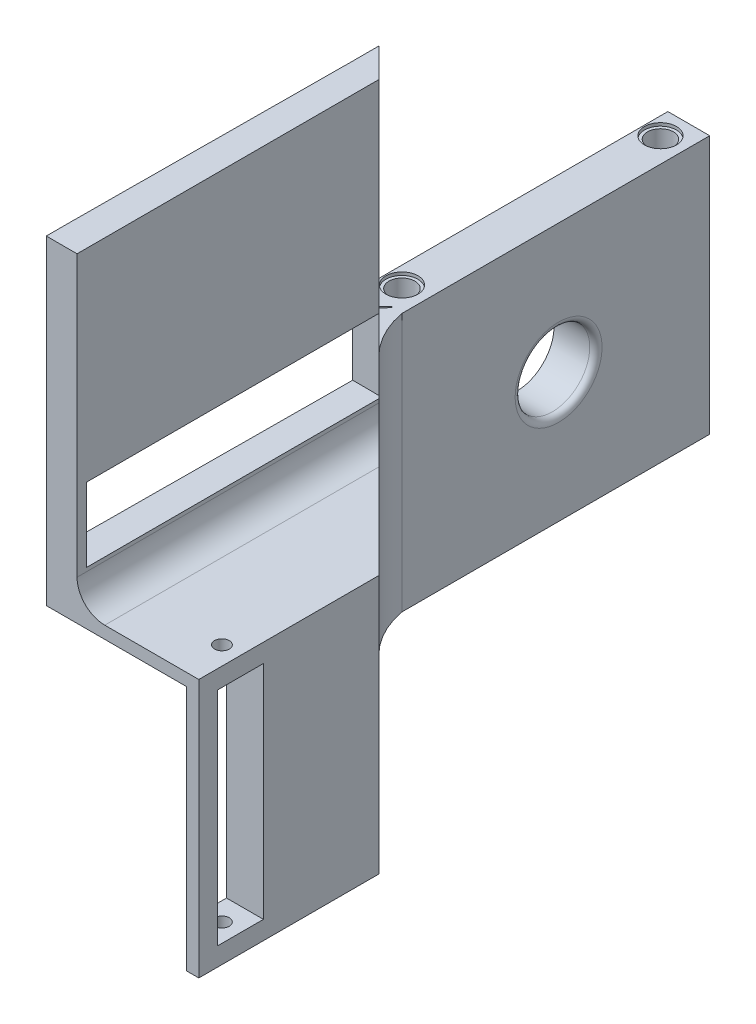
from build123d import *

# Parameters (mm, degrees)
SKETCH1_W           = 25
SKETCH1_H           = 50
SKETCH1_R           = 3.4
BOSS_EXTRUDE1_DEPTH = 3
SKETCH2_W           = 50
SKETCH2_H           = 3
BOSS_EXTRUDE2_DEPTH = 8
SKETCH3_W           = 8
SKETCH3_H           = 50
BOSS_EXTRUDE3_DEPTH = 42
SKETCH4_R           = 2.65
CUT_EXTRUDE1_DEPTH  = 0.5
SKETCH5_R           = 6.062177826
CUT_EXTRUDE2_DEPTH  = 9
FILLET2_R           = 1
SKETCH6_R           = 12.6
BOSS_EXTRUDE4_DEPTH = 2
FILLET4_R           = 1
SKETCH8_R           = 1.589780168
SKETCH8_R_2         = 1.777428262
CUT_EXTRUDE3_DEPTH  = 10
SKETCH9_W           = 49.021678163
SKETCH9_H           = 20.976854622
CUT_EXTRUDE4_DEPTH  = 68.79439129
SKETCH11_R          = 2.1
CUT_EXTRUDE5_DEPTH  = 59.480168703
SKETCH14_R          = 2.6
CUT_EXTRUDE6_DEPTH  = 0.5
BOSS_EXTRUDE5_DEPTH = 42
FILLET5_R           = 15
BOSS_EXTRUDE6_DEPTH = 42
SKETCH18_W          = 7.5
SKETCH18_H          = 36
CUT_EXTRUDE7_DEPTH  = 8
SKETCH19_R          = 1.2
CUT_EXTRUDE8_DEPTH  = 96.073366415
FILL_START          = -24.41711757
FILL_PATTERN1_DEPTH = 4.904046836
CHAMFER1_SIZE       = 4
CUT_EXTRUDE9_DEPTH  = 96.073366415
BOSS_EXTRUDE7_DEPTH = 2
BOSS_EXTRUDE8_DEPTH = 50
BOSS_EXTRUDE9_DEPTH = 4
SKETCH24_W          = 47.897956882
SKETCH24_H          = 11.99424148
CUT_EXTRUDE10_DEPTH = 6
FILLET7_R           = 4.5
SKETCH25_W          = 50
SKETCH25_H          = 42
CUT_EXTRUDE11_DEPTH = 1.2


# Read off the part's stored shape, not the designer's step: Fill Pattern1
with BuildPart() as part:
    # Sketch1 → Boss-Extrude1 (new body)
    with BuildSketch(Plane(origin=(0, 0, 0), x_dir=(1, 0, 0), z_dir=(0, 1, 0))):
        with Locations((2.276951673, 11.384758364)):
            Rectangle(SKETCH1_W, SKETCH1_H)
        with Locations(Location((1.276951673, 11.384758364, 0), (0, 0, 270))):
            Circle(SKETCH1_R, mode=Mode.SUBTRACT)
    extrude(amount=BOSS_EXTRUDE1_DEPTH)

    # Sketch2 → Boss-Extrude2 (add)
    with BuildSketch(Plane.ZY.offset(10.223048327)):
        with Locations((-11.384758364, 1.5)):
            Rectangle(SKETCH2_W, SKETCH2_H)
    extrude(amount=BOSS_EXTRUDE2_DEPTH)

    # Sketch3 → Boss-Extrude3 (add)
    with BuildSketch(Plane.XZ):
        with Locations((-14.223048327, -11.384758364)):
            Rectangle(SKETCH3_W, SKETCH3_H)
    extrude(amount=BOSS_EXTRUDE3_DEPTH)

    # Sketch4 → Cut-Extrude1 (cut)
    with BuildSketch(Plane(origin=(0, 3, 0), x_dir=(1, 0, 0), z_dir=(0, 1, 0))):
        with Locations(Location((-14.223048327, 32.384758364, 0), (0, 0, 270))):
            Circle(SKETCH4_R)
        with Locations(Location((-14.223048327, -9.615241636, 0), (0, 0, 270))):
            Circle(SKETCH4_R)
    cut_extrude1 = extrude(amount=-CUT_EXTRUDE1_DEPTH, mode=Mode.SUBTRACT)

    # Mirror1: Cut-Extrude1 across plane
    add(cut_extrude1.mirror(Plane.ZX.offset(-19.5)), mode=Mode.SUBTRACT)

    # Sketch5 → Cut-Extrude2 (cut)
    with BuildSketch(Plane.ZY.offset(18.223048327)):
        with Locations((-11.836279124, -21)):
            Circle(SKETCH5_R)
    extrude(amount=-CUT_EXTRUDE2_DEPTH, mode=Mode.SUBTRACT)

    # Fillet2
    fillet2_edges = [part.edges().sort_by_distance(p)[0] for p in [
        (-10.223048327, -21, -17.89845695),
    ]]
    fillet(fillet2_edges, radius=FILLET2_R)

    # Mirror2: Cut-Extrude1 across plane
    add(cut_extrude1.mirror(Plane.ZY.offset(1.723048327)), mode=Mode.SUBTRACT)

    # Sketch6 → Boss-Extrude4 (add)
    with BuildSketch(Plane(origin=(0, 3, 0), x_dir=(1, 0, 0), z_dir=(0, 1, 0))):
        with BuildLine():
            Line((14.776951673, 5.825082115), (14.776951673, 16.944434614))
            ThreePointArc((14.776951673, 16.944434614), (-13.323048327, 11.384758364), (14.776951673, 5.825082115))
        make_face()
        with Locations(Location((1.276951673, 11.384758364, 0), (0, 0, 270))):
            Circle(SKETCH6_R, mode=Mode.SUBTRACT)
    extrude(amount=BOSS_EXTRUDE4_DEPTH)

    # Fillet4
    # the kernel refuses this fillet: 1 mm, written as the material it takes off along each edge
    with BuildSketch(Plane(origin=(14.776951673, 5, -3.325082115), x_dir=(0, -1, 0), z_dir=(0, 0, -1))) as fillet4_piece_1:
        with BuildLine():
            CenterArc((FILLET4_R, FILLET4_R), FILLET4_R, 180, 90)
            Line((0, FILLET4_R), (0, 0))
            Line((0, 0), (FILLET4_R, 0))
        make_face()
    extrude(amount=16.119352499, mode=Mode.SUBTRACT)

    # Sketch8 → Cut-Extrude3 (cut)
    with BuildSketch(Plane(origin=(0, 3, 0), x_dir=(1, 0, 0), z_dir=(0, 1, 0))):
        with Locations(Location((1.276951673, 19.884758364, 0), (0, 0, 270))):
            Circle(SKETCH8_R)
        with Locations(Location((1.276951673, 2.884758364, 0), (0, 0, 270))):
            Circle(SKETCH8_R_2)
    extrude(amount=-CUT_EXTRUDE3_DEPTH, mode=Mode.SUBTRACT)

    # Sketch9 → Cut-Extrude4 (cut, through all)
    with BuildSketch(Plane.XY.offset(13.615241636)):
        with Locations((-9.733887409, 10.488427311)):
            Rectangle(SKETCH9_W, SKETCH9_H)
    extrude(amount=-CUT_EXTRUDE4_DEPTH, mode=Mode.SUBTRACT)

    # Sketch11 → Cut-Extrude5 (cut, through all)
    with BuildSketch(Plane(origin=(0, 0, 0), x_dir=(1, 0, 0), z_dir=(0, 1, 0))):
        with Locations(Location((-14.223048327, 32.384758364, 0), (0, 0, 270))):
            Circle(SKETCH11_R)
    cut_extrude5 = extrude(amount=-CUT_EXTRUDE5_DEPTH, mode=Mode.SUBTRACT)

    # Mirror3: Cut-Extrude5 across plane
    add(cut_extrude5.mirror(Plane.XY.offset(-11.384758364)), mode=Mode.SUBTRACT)

    # Sketch14 → Cut-Extrude6 (cut)
    with BuildSketch(Plane(origin=(0, 0, 0), x_dir=(1, 0, 0), z_dir=(0, 1, 0))):
        with Locations(Location((-14.223048327, -9.615241636, 0), (0, 0, 270))):
            Circle(SKETCH14_R)
    cut_extrude6 = extrude(amount=-CUT_EXTRUDE6_DEPTH, mode=Mode.SUBTRACT)

    # Mirror4: Cut-Extrude6 across plane
    add(cut_extrude6.mirror(Plane.XY.offset(-11.384758364)), mode=Mode.SUBTRACT)

    # Sketch16 → Boss-Extrude5 (add)
    with BuildSketch(Plane(origin=(0, 0, 0), x_dir=(1, 0, 0), z_dir=(0, 1, 0))):
        Polygon((-18.223048327, -13.615241636), (24.776951673, -56.615241636), (24.776951673, -52.372600949), (-13.98040764, -13.615241636), align=None)
    extrude(amount=-BOSS_EXTRUDE5_DEPTH)

    # Fillet5
    # the kernel refuses this fillet: 15 mm, written as the material it adds along each edge
    with BuildSketch(Plane(origin=(-13.98040764, 0, 13.615241636), x_dir=(1, 0, 0), z_dir=(0, -1, 0))) as fillet5_piece_1:
        with BuildLine():
            CenterArc((18.512169169, -2.701034267), FILLET5_R, 135, 34.626223963)
            Line((7.905567451, 7.905567451), (0, 0))
            Line((0, 0), (3.757359313, 0))
        make_face()
    extrude(amount=42)

    # Sketch17 → Boss-Extrude6 (add)
    with BuildSketch(Plane(origin=(0, 0, 0), x_dir=(1, 0, 0), z_dir=(0, 1, 0))):
        Polygon((24.776951673, -56.615241636), (24.776951673, -81.615241636), (18.776951673, -81.615241636), (18.776951673, -50.615241636), align=None)
    extrude(amount=-BOSS_EXTRUDE6_DEPTH)

    # Sketch18 → Cut-Extrude7 (cut)
    with BuildSketch(Plane(origin=(24.776951673, 0, 0), x_dir=(0, 0, -1), z_dir=(1, 0, 0))):
        with Locations((-74.865241636, -21)):
            Rectangle(SKETCH18_W, SKETCH18_H)
    extrude(amount=-CUT_EXTRUDE7_DEPTH, mode=Mode.SUBTRACT)

    # Sketch19 → Cut-Extrude8 (cut, through all)
    with BuildSketch(Plane(origin=(0, 0, 0), x_dir=(1, 0, 0), z_dir=(0, 1, 0))):
        with Locations(Location((21.776951673, -74.865241636, 0), (0, 0, 270))):
            Circle(SKETCH19_R)
    extrude(amount=-CUT_EXTRUDE8_DEPTH, mode=Mode.SUBTRACT)

    # Fill Pattern1 outline → Fill Pattern1 (cut)
    with BuildSketch(Plane(origin=(0, 0, 0), x_dir=(0.7071067811865468, 0, 0.7071067811865482), z_dir=(0.7071067811865481, 0, -0.707106781186547)).offset(FILL_START)):
        Polygon((45.971737286, 5.859685187), (47.221737286, 3.694621678), (49.721737286, 3.694621678), (50.971737286, 5.859685187), (49.721737286, 8.024748697), (47.221737286, 8.024748697), align=None)
        Polygon((30.237460587, 33.11225185), (31.487460587, 30.947188341), (33.987460587, 30.947188341), (35.237460587, 33.11225185), (33.987460587, 35.27731536), (31.487460587, 35.27731536), align=None)
        Polygon((40.726978386, 14.943874075), (41.976978386, 12.778810565), (44.476978386, 12.778810565), (45.726978386, 14.943874075), (44.476978386, 17.108937584), (41.976978386, 17.108937584), align=None)
        Polygon((35.482219487, 24.028062963), (36.732219487, 21.862999453), (39.232219487, 21.862999453), (40.482219487, 24.028062963), (39.232219487, 26.193126472), (36.732219487, 26.193126472), align=None)
        Polygon((15.753183888, 3.694621678), (18.253183888, 3.694621678), (19.503183888, 5.859685187), (18.253183888, 8.024748697), (15.753183888, 8.024748697), (14.503183888, 5.859685187), align=None)
        Polygon((26.242701687, 3.694621678), (28.742701687, 3.694621678), (29.992701687, 5.859685187), (28.742701687, 8.024748697), (26.242701687, 8.024748697), (24.992701687, 5.859685187), align=None)
        Polygon((36.732219487, 3.694621678), (39.232219487, 3.694621678), (40.482219487, 5.859685187), (39.232219487, 8.024748697), (36.732219487, 8.024748697), (35.482219487, 5.859685187), align=None)
        Polygon((45.971737286, 11.915811112), (47.221737286, 9.750747603), (49.721737286, 9.750747603), (50.971737286, 11.915811112), (49.721737286, 14.080874622), (47.221737286, 14.080874622), align=None)
        Polygon((40.726978386, 21), (41.976978386, 18.834936491), (44.476978386, 18.834936491), (45.726978386, 21), (44.476978386, 23.165063509), (41.976978386, 23.165063509), align=None)
        Polygon((35.482219487, 30.084188888), (36.732219487, 27.919125378), (39.232219487, 27.919125378), (40.482219487, 30.084188888), (39.232219487, 32.249252397), (36.732219487, 32.249252397), align=None)
        Polygon((15.753183888, 9.750747603), (18.253183888, 9.750747603), (19.503183888, 11.915811112), (18.253183888, 14.080874622), (15.753183888, 14.080874622), (14.503183888, 11.915811112), align=None)
        Polygon((26.242701687, 9.750747603), (28.742701687, 9.750747603), (29.992701687, 11.915811112), (28.742701687, 14.080874622), (26.242701687, 14.080874622), (24.992701687, 11.915811112), align=None)
        Polygon((36.732219487, 9.750747603), (39.232219487, 9.750747603), (40.482219487, 11.915811112), (39.232219487, 14.080874622), (36.732219487, 14.080874622), (35.482219487, 11.915811112), align=None)
        Polygon((45.971737286, 17.971937037), (47.221737286, 15.806873528), (49.721737286, 15.806873528), (50.971737286, 17.971937037), (49.721737286, 20.137000547), (47.221737286, 20.137000547), align=None)
        Polygon((40.726978386, 27.056125925), (41.976978386, 24.891062416), (44.476978386, 24.891062416), (45.726978386, 27.056125925), (44.476978386, 29.221189435), (41.976978386, 29.221189435), align=None)
        Polygon((35.482219487, 36.140314813), (36.732219487, 33.975251303), (39.232219487, 33.975251303), (40.482219487, 36.140314813), (39.232219487, 38.305378322), (36.732219487, 38.305378322), align=None)
        Polygon((15.753183888, 15.806873528), (18.253183888, 15.806873528), (19.503183888, 17.971937037), (18.253183888, 20.137000547), (15.753183888, 20.137000547), (14.503183888, 17.971937037), align=None)
        Polygon((26.242701687, 15.806873528), (28.742701687, 15.806873528), (29.992701687, 17.971937037), (28.742701687, 20.137000547), (26.242701687, 20.137000547), (24.992701687, 17.971937037), align=None)
        Polygon((36.732219487, 15.806873528), (39.232219487, 15.806873528), (40.482219487, 17.971937037), (39.232219487, 20.137000547), (36.732219487, 20.137000547), (35.482219487, 17.971937037), align=None)
        Polygon((44.476978386, 6.72268464), (45.726978386, 8.88774815), (44.476978386, 11.052811659), (41.976978386, 11.052811659), (40.726978386, 8.88774815), (41.976978386, 6.72268464), align=None)
        Polygon((45.971737286, 24.028062963), (47.221737286, 21.862999453), (49.721737286, 21.862999453), (50.971737286, 24.028062963), (49.721737286, 26.193126472), (47.221737286, 26.193126472), align=None)
        Polygon((40.726978386, 33.11225185), (41.976978386, 30.947188341), (44.476978386, 30.947188341), (45.726978386, 33.11225185), (44.476978386, 35.27731536), (41.976978386, 35.27731536), align=None)
        Polygon((15.753183888, 21.862999453), (18.253183888, 21.862999453), (19.503183888, 24.028062963), (18.253183888, 26.193126472), (15.753183888, 26.193126472), (14.503183888, 24.028062963), align=None)
        Polygon((26.242701687, 21.862999453), (28.742701687, 21.862999453), (29.992701687, 24.028062963), (28.742701687, 26.193126472), (26.242701687, 26.193126472), (24.992701687, 24.028062963), align=None)
        Polygon((45.971737286, 36.140314813), (47.221737286, 33.975251303), (49.721737286, 33.975251303), (50.971737286, 36.140314813), (49.721737286, 38.305378322), (47.221737286, 38.305378322), align=None)
        Polygon((15.753183888, 33.975251303), (18.253183888, 33.975251303), (19.503183888, 36.140314813), (18.253183888, 38.305378322), (15.753183888, 38.305378322), (14.503183888, 36.140314813), align=None)
        Polygon((26.242701687, 33.975251303), (28.742701687, 33.975251303), (29.992701687, 36.140314813), (28.742701687, 38.305378322), (26.242701687, 38.305378322), (24.992701687, 36.140314813), align=None)
        Polygon((33.987460587, 6.72268464), (35.237460587, 8.88774815), (33.987460587, 11.052811659), (31.487460587, 11.052811659), (30.237460587, 8.88774815), (31.487460587, 6.72268464), align=None)
        Polygon((45.971737286, 30.084188888), (47.221737286, 27.919125378), (49.721737286, 27.919125378), (50.971737286, 30.084188888), (49.721737286, 32.249252397), (47.221737286, 32.249252397), align=None)
        Polygon((15.753183888, 27.919125378), (18.253183888, 27.919125378), (19.503183888, 30.084188888), (18.253183888, 32.249252397), (15.753183888, 32.249252397), (14.503183888, 30.084188888), align=None)
        Polygon((26.242701687, 27.919125378), (28.742701687, 27.919125378), (29.992701687, 30.084188888), (28.742701687, 32.249252397), (26.242701687, 32.249252397), (24.992701687, 30.084188888), align=None)
        Polygon((19.747942788, 27.056125925), (20.997942788, 24.891062416), (23.497942788, 24.891062416), (24.747942788, 27.056125925), (23.497942788, 29.221189435), (20.997942788, 29.221189435), align=None)
        Polygon((19.747942788, 8.88774815), (20.997942788, 6.72268464), (23.497942788, 6.72268464), (24.747942788, 8.88774815), (23.497942788, 11.052811659), (20.997942788, 11.052811659), align=None)
        Polygon((33.987460587, 24.891062416), (35.237460587, 27.056125925), (33.987460587, 29.221189435), (31.487460587, 29.221189435), (30.237460587, 27.056125925), (31.487460587, 24.891062416), align=None)
        Polygon((19.747942788, 14.943874075), (20.997942788, 12.778810565), (23.497942788, 12.778810565), (24.747942788, 14.943874075), (23.497942788, 17.108937584), (20.997942788, 17.108937584), align=None)
        Polygon((31.487460587, 12.778810565), (33.987460587, 12.778810565), (35.237460587, 14.943874075), (33.987460587, 17.108937584), (31.487460587, 17.108937584), (30.237460587, 14.943874075), align=None)
        Polygon((19.747942788, 21), (20.997942788, 18.834936491), (23.497942788, 18.834936491), (24.747942788, 21), (23.497942788, 23.165063509), (20.997942788, 23.165063509), align=None)
        Polygon((31.487460587, 18.834936491), (33.987460587, 18.834936491), (35.237460587, 21), (33.987460587, 23.165063509), (31.487460587, 23.165063509), (30.237460587, 21), align=None)
        Polygon((20.997942788, 30.947188341), (23.497942788, 30.947188341), (24.747942788, 33.11225185), (23.497942788, 35.27731536), (20.997942788, 35.27731536), (19.747942788, 33.11225185), align=None)
    extrude(amount=FILL_PATTERN1_DEPTH, mode=Mode.SUBTRACT)

    # Chamfer1
    # the kernel refuses this chamfer: 4 mm, written as the material it takes off along each edge
    with BuildSketch(Plane(origin=(18.776951673, 10.286731952, 81.615241636), x_dir=(0.9996219169112968, 0, 0.027495876610585623), z_dir=(0, -1, 0))) as chamfer1_piece_1:
        Polygon((CHAMFER1_SIZE * 0.999621916911, -CHAMFER1_SIZE * 0.0274958766106), (-CHAMFER1_SIZE * 0.0274958766106, -CHAMFER1_SIZE * 0.999621916911), (0, 0), align=None)
    extrude(amount=62.573463904, mode=Mode.SUBTRACT)

    # Sketch20 → Cut-Extrude9 (cut, through all)
    with BuildSketch(Plane(origin=(0, 0, 0), x_dir=(1, 0, 0), z_dir=(0, 1, 0))):
        Polygon((-12.007369699, -13.422049918), (-13.646299524, -15.19356362), (-10.796749548, -17.829847178), (-10.525107778, -17.536230508), (-13.131913788, -15.124523438), (-11.876337797, -13.615241636), align=None)
    extrude(amount=-CUT_EXTRUDE9_DEPTH, mode=Mode.SUBTRACT)

    # Sketch21 → Boss-Extrude7 (add)
    with BuildSketch(Plane(origin=(0, 0, 0), x_dir=(1, 0, 0), z_dir=(0, 1, 0))):
        Polygon((18.776951673, -77.615241636), (0, -77.615241636), (0.276951673, -32.115241636), (18.776951673, -50.615241636), align=None)
    extrude(amount=-BOSS_EXTRUDE7_DEPTH)

    # Sketch22 → Boss-Extrude8 (add)
    with BuildSketch(Plane(origin=(0, 0, 0), x_dir=(1, 0, 0), z_dir=(0, 1, 0))):
        Polygon((0, -77.615241636), (0.276951673, -32.115241636), (0.276951673, -27.872600949), (5, -32.595649276), (5, -77.615241636), align=None)
    extrude(amount=BOSS_EXTRUDE8_DEPTH)

    # Sketch23 → Boss-Extrude9 (add)
    with BuildSketch(Plane.XY.offset(81.615241636)):
        Polygon((22.776951673, 0), (5, 0), (5, 50), (0, 50), (0, -2), (22.776951673, -2), align=None)
    extrude(amount=-BOSS_EXTRUDE9_DEPTH)

    # Sketch24 → Cut-Extrude10 (cut)
    with BuildSketch(Plane(origin=(0.472414827, 0, 0.002875518), x_dir=(-0.006086737198043909, 0, 0.9999814756435651), z_dir=(-0.9999814756435652, 0, -0.0060867371980439094))):
        with Locations((56.06193943, 11.101483244)):
            Rectangle(SKETCH24_W, SKETCH24_H)
    extrude(amount=-CUT_EXTRUDE10_DEPTH, mode=Mode.SUBTRACT)

    # Fillet7
    fillet7_edges = [part.edges().sort_by_distance(p)[0] for p in [
        (5, 0, 57.105445456),
    ]]
    fillet(fillet7_edges, radius=FILLET7_R)

    # Sketch25 → Cut-Extrude11 (cut)
    with BuildSketch(Plane.ZY.offset(18.223048327)):
        with Locations((-11.384758364, -21)):
            Rectangle(SKETCH25_W, SKETCH25_H)
    extrude(amount=-CUT_EXTRUDE11_DEPTH, mode=Mode.SUBTRACT)


solid = part.part
